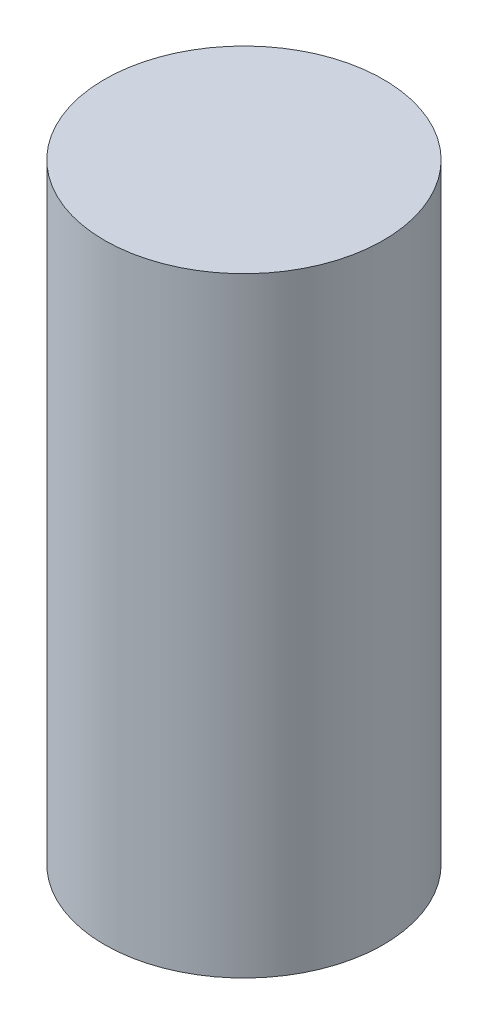
from build123d import *

# Parameters (mm, degrees)
SKETCH1_R           = 228.6
BOSS_EXTRUDE1_DEPTH = 1000


with BuildPart() as part:
    # Sketch1 → Boss-Extrude1 (new body)
    with BuildSketch(Plane(origin=(0, 0, 0), x_dir=(1, 0, 0), z_dir=(0, 1, 0))):
        Circle(SKETCH1_R)
    extrude(amount=BOSS_EXTRUDE1_DEPTH)


solid = part.part
